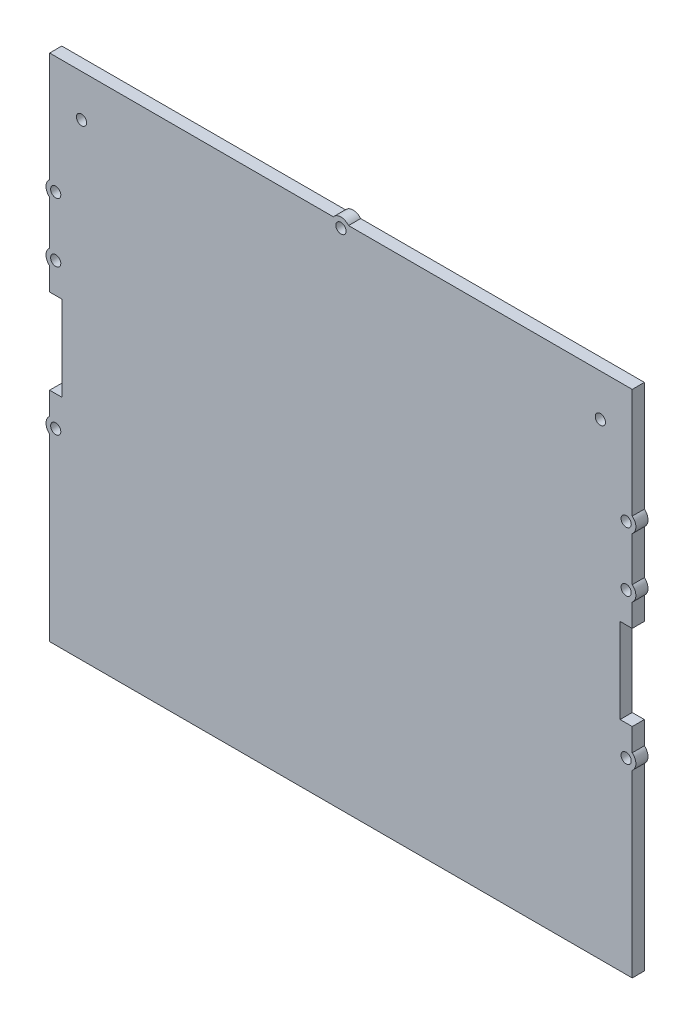
from build123d import *

# Parameters (mm, degrees)
BOSS_EXTRUDE1_DEPTH = 5
SKETCH7_R           = 2.1
CUT_EXTRUDE2_DEPTH  = 5
SKETCH8_R           = 2.1
SKETCH8_W           = 5
SKETCH8_H           = 35
CUT_EXTRUDE3_DEPTH  = 5
BOSS_EXTRUDE2_DEPTH = 5


with BuildPart() as part:
    # Sketch1 → Boss-Extrude1 (new body)
    with BuildSketch(Plane.XY):
        Polygon((120, 105), (-120, 105), (-120, 40), (-120, -40), (-120, -105), (120, -105), (120, -40), (120, 40), align=None)
    extrude(amount=BOSS_EXTRUDE1_DEPTH)

    # Sketch7 → Cut-Extrude2 (cut)
    with BuildSketch(Plane.XY.offset(5)):
        with Locations((117.5, 56.659952407)):
            Circle(SKETCH7_R)
        with Locations((106.863886883, 87.726296546)):
            Circle(SKETCH7_R)
        with Locations((0, 102.5)):
            Circle(SKETCH7_R)
        with Locations((-117.5, 56.659952407)):
            Circle(SKETCH7_R)
        with Locations((-106.863886883, 87.726296546)):
            Circle(SKETCH7_R)
    extrude(amount=-CUT_EXTRUDE2_DEPTH, mode=Mode.SUBTRACT)

    # Sketch8 → Cut-Extrude3 (cut)
    with BuildSketch(Plane.XY.offset(5)):
        with Locations((-117.5, 32.214734358)):
            Circle(SKETCH8_R)
        with Locations((-117.5, -27.785265642)):
            Circle(SKETCH8_R)
        with Locations((117.5, -27.785265642)):
            Circle(SKETCH8_R)
        with Locations((117.5, 32.214734358)):
            Circle(SKETCH8_R)
        with Locations((-117.5, 2.214734358)):
            Rectangle(SKETCH8_W, SKETCH8_H)
        with Locations((117.5, 2.214734358)):
            Rectangle(SKETCH8_W, SKETCH8_H)
    extrude(amount=-CUT_EXTRUDE3_DEPTH, mode=Mode.SUBTRACT)

    # Sketch9 → Boss-Extrude2 (add)
    with BuildSketch(Plane.XY.offset(5)):
        with BuildLine():
            Line((120, 59.782451406), (120, 53.537453408))
            ThreePointArc((120, 53.537453408), (121.5, 56.659952407), (120, 59.782451406))
        make_face()
        with BuildLine():
            Line((120, 35.337233357), (120, 29.092235358))
            ThreePointArc((120, 29.092235358), (121.5, 32.214734358), (120, 35.337233357))
        make_face()
        with BuildLine():
            Line((120, -24.662766643), (120, -30.907764642))
            ThreePointArc((120, -30.907764642), (121.5, -27.785265642), (120, -24.662766643))
        make_face()
        with BuildLine():
            Line((-3.122498999, 105), (3.122498999, 105))
            ThreePointArc((3.122498999, 105), (0, 106.5), (-3.122498999, 105))
        make_face()
        with BuildLine():
            Line((-120, -24.662766643), (-120, -30.907764642))
            ThreePointArc((-120, -30.907764642), (-121.5, -27.785265642), (-120, -24.662766643))
        make_face()
        with BuildLine():
            Line((-120, 35.337233357), (-120, 29.092235358))
            ThreePointArc((-120, 29.092235358), (-121.5, 32.214734358), (-120, 35.337233357))
        make_face()
        with BuildLine():
            Line((-120, 59.782451406), (-120, 53.537453408))
            ThreePointArc((-120, 53.537453408), (-121.5, 56.659952407), (-120, 59.782451406))
        make_face()
    extrude(amount=-BOSS_EXTRUDE2_DEPTH)


solid = part.part
